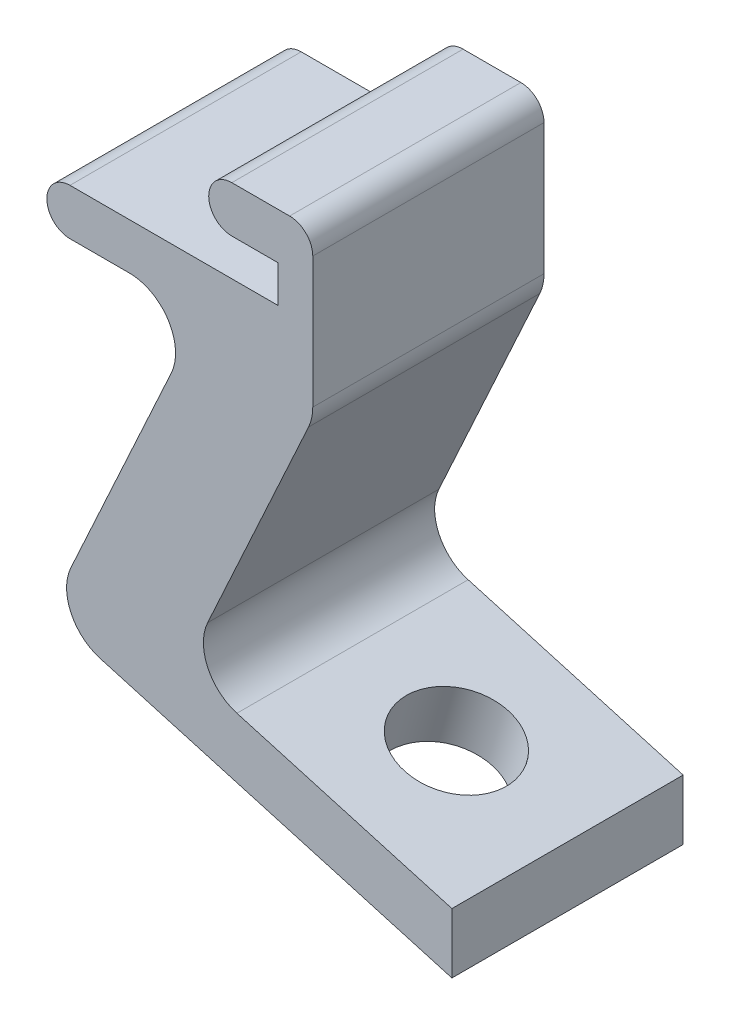
from build123d import *

# Parameters (mm, degrees)
BOSS_EXTRUDE1_DEPTH = 10
FILLET1_R           = 1
SKETCH3_R           = 2.25
CUT_EXTRUDE1_DEPTH  = 5


with BuildPart() as part:
    # Sketch2 → Boss-Extrude1 (new body)
    with BuildSketch(Plane.XY):
        with BuildLine():
            Line((-1.5, 9.9700831), (-1.5, 7.9700831))
            Line((-1.5, 7.9700831), (1.5, 7.9700831))
            Line((1.5, 7.9700831), (1.5, 6.3700831))
            Line((1.5, 6.3700831), (-8.5, 6.3700831))
            Line((-8.5, 6.3700831), (-8.5, 4.3700831))
            Line((-8.5, 4.3700831), (-4.933456572, 4.3700831))
            ThreePointArc((-4.933456572, 4.3700831), (-3.249951556, 3.449810315), (-3.115730388, 1.535893959))
            Line((-3.115730388, 1.535893959), (-7.463599773, -7.938259613))
            ThreePointArc((-7.463599773, -7.938259613), (-7.463263835, -9.607369524), (-6.197148301, -10.694972145))
            Line((-6.197148301, -10.694972145), (9.017188246, -15.057612947))
            Line((9.017188246, -15.057612947), (9.017188246, -12.456864357))
            Line((9.017188246, -12.456864357), (-0.280787764, -9.79071264))
            ThreePointArc((-0.280787764, -9.79071264), (-1.546903298, -8.703110018), (-1.547239236, -7.034000107))
            Line((-1.547239236, -7.034000107), (2.817726184, 2.4774063))
            ThreePointArc((2.817726184, 2.4774063), (2.953900249, 2.884660063), (3, 3.31159544))
            Line((3, 3.31159544), (3, 9.9700831))
            Line((3, 9.9700831), (-1.5, 9.9700831))
        make_face()
    extrude(amount=BOSS_EXTRUDE1_DEPTH)

    # Fillet1
    fillet1_edges = [part.edges().sort_by_distance(p)[0] for p in [
        (-8.5, 6.3700831, 5),
        (-1.5, 7.9700831, 5),
        (-1.5, 9.9700831, 5),
        (3, 9.9700831, 5),
        (-8.5, 4.3700831, 5),
    ]]
    fillet(fillet1_edges, radius=FILLET1_R - 0.0001)  # a hair under: the kernel refuses the full size

    # Sketch3 → Cut-Extrude1 (cut)
    with BuildSketch(Plane(origin=(-2.615476737, -9.121251349, 0), x_dir=(0.9612616959383208, -0.27563735581699245, 0), z_dir=(0.27563735581699245, 0.9612616959383208, 0))):
        with Locations(Location((7.101454819, -5, 0), (0, 0, 180))):
            Circle(SKETCH3_R)
    extrude(amount=-CUT_EXTRUDE1_DEPTH, mode=Mode.SUBTRACT)


solid = part.part
